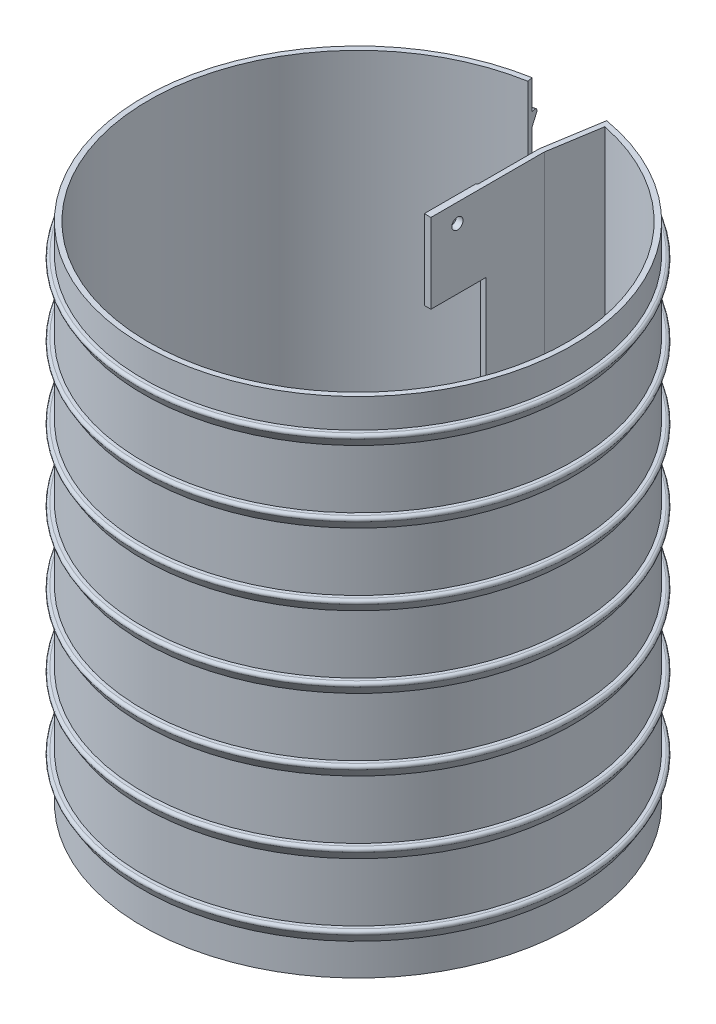
from build123d import *

# Parameters (mm, degrees)
RESSALTO_EXTRUS_O1_DEPTH = 190
PADR_O_LINEAR1_COUNT     = 7
PADR_O_LINEAR1_PITCH     = 27
RESSALTO_EXTRUS_O2_DEPTH = 30
CORTE_EXTRUS_O1_REACH    = 230.458
ESBO_O5_R                = 2.1


with BuildPart() as part:
    # Esboço1 → Ressalto-extrusão1 (new body)
    with BuildSketch(Plane(origin=(0, 0, 0), x_dir=(1, 0, 0), z_dir=(0, 1, 0))):
        with BuildLine():
            Line((-13.718206036, 77.799812488), (-14.065502391, 79.769427994))
            ThreePointArc((-14.065502391, 79.769427994), (0, -81), (14.065502391, 79.769427994))
            Line((14.065502391, 79.769427994), (13.718206036, 77.799812488))
            Line((13.718206036, 77.799812488), (10.5, 57.8))
            Line((10.5, 57.8), (10.5, 35.8))
            Line((10.5, 35.8), (12.5, 35.8))
            Line((12.5, 35.8), (12.5, 57.8))
            Line((12.5, 57.8), (15.659101617, 77.432503101))
            ThreePointArc((15.659101617, 77.432503101), (-0.987673003, -78.993825721), (-13.718206036, 77.799812488))
        make_face()
    extrude(amount=RESSALTO_EXTRUS_O1_DEPTH)

    # Varredura1: sweep along a path in Esboço3
    with BuildLine(Plane(origin=(0, 13, 0), x_dir=(1, 0, 0), z_dir=(0, 1, 0))) as varredura1_path:
        ThreePointArc((-14.15232648, 80.26183187), (0, -81.5), (14.15232648, 80.26183187))
    # Esboço2 → Varredura1 (sweep)
    with BuildSketch(Plane(origin=(0, 0, 0), x_dir=(-0.1736481776669239, 0, -0.9848077530122092), z_dir=(0.9848077530122091, 0, -0.17364817766692386))):
        with BuildLine():
            Line((81, 12), (81, 17))
            Line((81, 17), (82.233809621, 17))
            ThreePointArc((82.233809621, 17), (83.104009528, 16.492698815), (83.091302547, 15.485504245))
            Line((83.091302547, 15.485504245), (81, 12))
        make_face()
    varredura1 = sweep(path=varredura1_path.line)

    # Padrão linear1: Varredura1 ×7
    with Locations(*[(0, i * PADR_O_LINEAR1_PITCH, 0) for i in range(1, PADR_O_LINEAR1_COUNT)]):
        add(varredura1)

    # Esboço4 → Ressalto-extrusão2 (add)
    with BuildSketch(Plane(origin=(0, 190, 0), x_dir=(1, 0, 0), z_dir=(0, 1, 0))):
        Polygon((10.5, 35.8), (10.5, 35), (10, 34.5), (10, 15), (12.5, 15), (12.5, 35.8), align=None)
    extrude(amount=-RESSALTO_EXTRUS_O2_DEPTH)

    # Esboço5 → Corte-extrusão1 (cut, up to next)
    with BuildSketch(Plane(origin=(12.5, 0, 0), x_dir=(0, 0, -1), z_dir=(1, 0, 0)), mode=Mode.PRIVATE) as corte_extrus_o1_sk1:
        with Locations((25, 183)):
            Circle(ESBO_O5_R)
    corte_extrus_o1_tool1 = extrude(corte_extrus_o1_sk1.sketch, amount=-CORTE_EXTRUS_O1_REACH, mode=Mode.PRIVATE) & part.part
    add(corte_extrus_o1_tool1.solids().sort_by_distance((12.5, 183, -25))[0], mode=Mode.SUBTRACT)


solid = part.part
